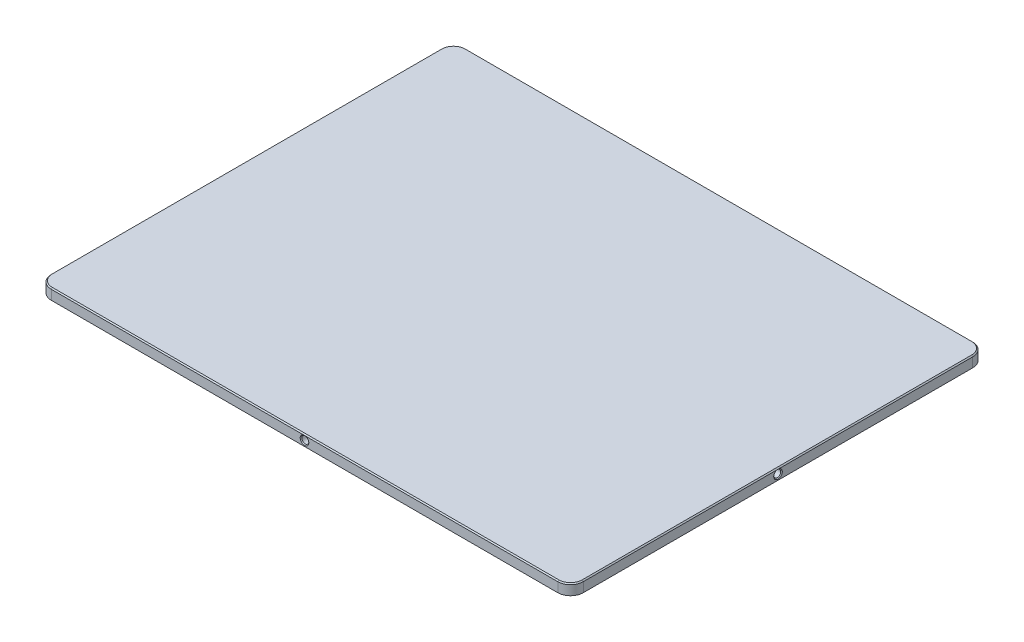
from build123d import *

# Parameters (mm, degrees)
SKETCH_1_W                   = 250
SKETCH_1_H                   = 195
EXTRUDE_377_DEPTH            = 5
HOLE_WIZARD_1_M4_D           = 3.3
HOLE_WIZARD_1_M4_DEPTH       = 40
HOLE_WIZARD_1_M4_CSINK_D     = 4.05
HOLE_WIZARD_1_M4_CSINK_ANGLE = 90
HOLE_WIZARD_1_M4_TIP         = 0.991420021
HOLE_WIZARD_2_M4_D           = 3.3
HOLE_WIZARD_2_M4_DEPTH       = 40
HOLE_WIZARD_2_M4_CSINK_D     = 4.05
HOLE_WIZARD_2_M4_CSINK_ANGLE = 90
HOLE_WIZARD_2_M4_TIP         = 0.991420021
HOLE_WIZARD_3_M4_D           = 3.3
HOLE_WIZARD_3_M4_DEPTH       = 40
HOLE_WIZARD_3_M4_CSINK_D     = 4.05
HOLE_WIZARD_3_M4_CSINK_ANGLE = 90
HOLE_WIZARD_3_M4_TIP         = 0.991420021
FILLET_1_R                   = 6
CHAMFER_1_SIZE               = 0.5


with BuildPart() as part:
    # Эскиз1 → Extrude 377 (new body)
    with BuildSketch(Plane(origin=(0, 0, 0), x_dir=(1, 0, 0), z_dir=(0, 1, 0))):
        Rectangle(SKETCH_1_W, SKETCH_1_H)
    extrude(amount=EXTRUDE_377_DEPTH)

    # Резьба-1-M4
    with Locations(Plane(origin=(125, 0, 0), x_dir=(0, 0, -1), z_dir=(1, 0, 0))):
        with Locations((0, 2.5)):
            CounterSinkHole(HOLE_WIZARD_1_M4_D / 2, HOLE_WIZARD_1_M4_CSINK_D / 2, depth=HOLE_WIZARD_1_M4_DEPTH, counter_sink_angle=HOLE_WIZARD_1_M4_CSINK_ANGLE)
            with Locations((0, 0, -(HOLE_WIZARD_1_M4_DEPTH + HOLE_WIZARD_1_M4_TIP / 2))):  # 118° drill point
                Cone(0, HOLE_WIZARD_1_M4_D / 2, HOLE_WIZARD_1_M4_TIP, mode=Mode.SUBTRACT)

    # Резьба-2-M4
    with Locations(Plane.ZY.offset(125)):
        with Locations((0, 2.5)):
            CounterSinkHole(HOLE_WIZARD_2_M4_D / 2, HOLE_WIZARD_2_M4_CSINK_D / 2, depth=HOLE_WIZARD_2_M4_DEPTH, counter_sink_angle=HOLE_WIZARD_2_M4_CSINK_ANGLE)
            with Locations((0, 0, -(HOLE_WIZARD_2_M4_DEPTH + HOLE_WIZARD_2_M4_TIP / 2))):  # 118° drill point
                Cone(0, HOLE_WIZARD_2_M4_D / 2, HOLE_WIZARD_2_M4_TIP, mode=Mode.SUBTRACT)

    # Резьба-3-M4
    with Locations(Plane.XY.offset(97.5)):
        with Locations((0, 2.5)):
            CounterSinkHole(HOLE_WIZARD_3_M4_D / 2, HOLE_WIZARD_3_M4_CSINK_D / 2, depth=HOLE_WIZARD_3_M4_DEPTH, counter_sink_angle=HOLE_WIZARD_3_M4_CSINK_ANGLE)
            with Locations((0, 0, -(HOLE_WIZARD_3_M4_DEPTH + HOLE_WIZARD_3_M4_TIP / 2))):  # 118° drill point
                Cone(0, HOLE_WIZARD_3_M4_D / 2, HOLE_WIZARD_3_M4_TIP, mode=Mode.SUBTRACT)

    # Скругление1
    fillet_1_edges = [part.edges().sort_by_distance(p)[0] for p in [
        (125, 2.5, 97.5),
        (-125, 2.5, 97.5),
        (-125, 2.5, -97.5),
        (125, 2.5, -97.5),
    ]]
    fillet(fillet_1_edges, radius=FILLET_1_R)

    # Фаска1
    # the kernel refuses this chamfer: 0.5 mm, written as the material it takes off along each edge
    with BuildSketch(Plane(origin=(-119, 5, -97.5), x_dir=(0, -0.999621916911297, -0.0274958766105822), z_dir=(1, 0, 0))) as chamfer_1_piece_1:
        Polygon((CHAMFER_1_SIZE * 0.999621916911, -CHAMFER_1_SIZE * 0.0274958766106), (-CHAMFER_1_SIZE * 0.0274958766106, -CHAMFER_1_SIZE * 0.999621916911), (0, 0), align=None)
    extrude(amount=238, mode=Mode.SUBTRACT)
    with BuildSketch(Plane(origin=(125, 5, -91.5), x_dir=(-0.9996219169112968, 0.02749587661058574, 0), z_dir=(0, 0, 1)), Plane(origin=(-125, 5, 91.5), x_dir=(0.9996219169112968, 0.02749587661058574, 0), z_dir=(0, 0, -1))) as chamfer_1_piece_2:
        Polygon((CHAMFER_1_SIZE * 0.999621916911, CHAMFER_1_SIZE * 0.0274958766106), (-CHAMFER_1_SIZE * 0.0274958766106, CHAMFER_1_SIZE * 0.999621916911), (0, 0), align=None)
    extrude(amount=183, mode=Mode.SUBTRACT)
    with BuildSketch(Plane(origin=(119, 5, 97.5), x_dir=(0, 0.02749587661058574, -0.9996219169112968), z_dir=(-1, 0, 0))) as chamfer_1_piece_3:
        Polygon((CHAMFER_1_SIZE * 0.999621916911, CHAMFER_1_SIZE * 0.0274958766106), (-CHAMFER_1_SIZE * 0.0274958766106, CHAMFER_1_SIZE * 0.999621916911), (0, 0), align=None)
    extrude(amount=238, mode=Mode.SUBTRACT)
    with BuildSketch(Plane(origin=(-119, 5, 91.5), x_dir=(0, 0, 1), z_dir=(1, 0, 0))) as chamfer_1_piece_4:
        Polygon((6 - CHAMFER_1_SIZE, 0), (6, CHAMFER_1_SIZE), (6, 0), align=None)
    revolve(axis=Axis((-119, 5, 91.5), (0, -1, 0)), revolution_arc=90, mode=Mode.SUBTRACT)
    with BuildSketch(Plane(origin=(119, 5, 91.5), x_dir=(0, 0, 1), z_dir=(-1, 0, 0))) as chamfer_1_piece_5:
        Polygon((6 - CHAMFER_1_SIZE, 0), (6, -CHAMFER_1_SIZE), (6, 0), align=None)
    revolve(axis=Axis((119, 5, 91.5), (0, 1, 0)), revolution_arc=90, mode=Mode.SUBTRACT)
    with BuildSketch(Plane(origin=(-119, 5, -91.5), x_dir=(0, 0, -1), z_dir=(1, 0, 0))) as chamfer_1_piece_6:
        Polygon((6, -CHAMFER_1_SIZE), (6 - CHAMFER_1_SIZE, 0), (6, 0), align=None)
    revolve(axis=Axis((-119, 5, -91.5), (0, 1, 0)), revolution_arc=90, mode=Mode.SUBTRACT)
    with BuildSketch(Plane(origin=(119, 5, -91.5), x_dir=(0, 0, -1), z_dir=(-1, 0, 0))) as chamfer_1_piece_7:
        Polygon((6, CHAMFER_1_SIZE), (6 - CHAMFER_1_SIZE, 0), (6, 0), align=None)
    revolve(axis=Axis((119, 5, -91.5), (0, -1, 0)), revolution_arc=90, mode=Mode.SUBTRACT)


solid = part.part
